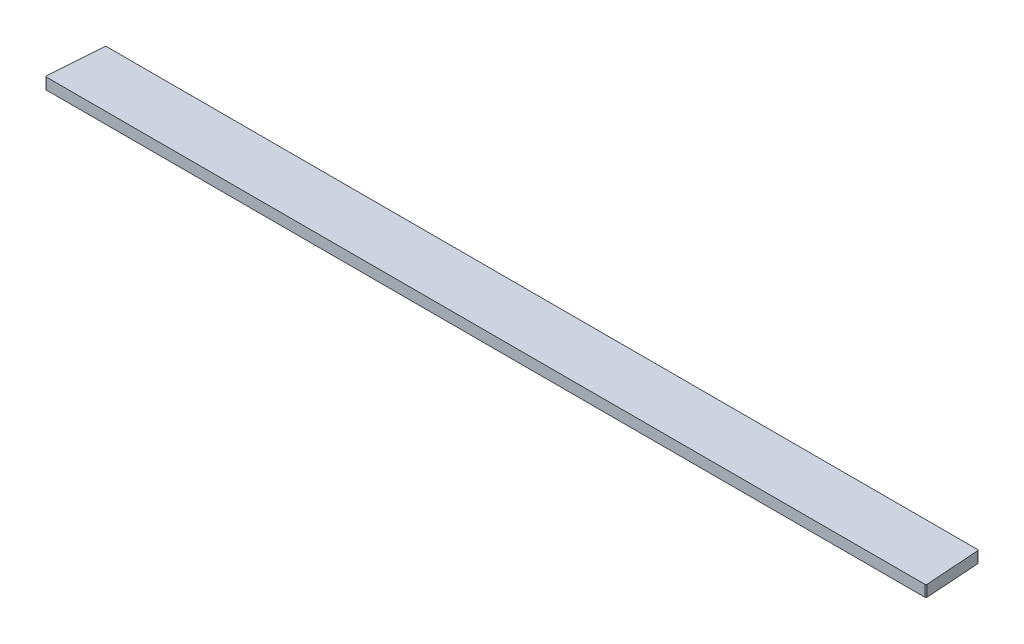
from build123d import *

# Parameters (mm, degrees)
BASE_FLANGE1_DEPTH = 10
FILLET_1_0_R       = 1


# Sheet-metal steps are written as plain solids
with BuildPart() as part:
    # Sketch1 → Base-Flange1 (new body)
    with BuildSketch(Plane(origin=(0, 0, 0), x_dir=(1, 0, 0), z_dir=(0, 1, 0))):
        Polygon((-386.503659403, 50), (386.503659403, 50), (390, 0), (-390, 0), align=None)
    extrude(amount=-BASE_FLANGE1_DEPTH)

    # Fillet-1.0
    fillet_1_0_edges = [part.edges().sort_by_distance(p)[0] for p in [
        (-386.503659403, -5, -50),
        (386.503659403, -5, -50),
        (390, -5, 0),
        (-390, -5, 0),
    ]]
    fillet(fillet_1_0_edges, radius=FILLET_1_0_R)


solid = part.part
